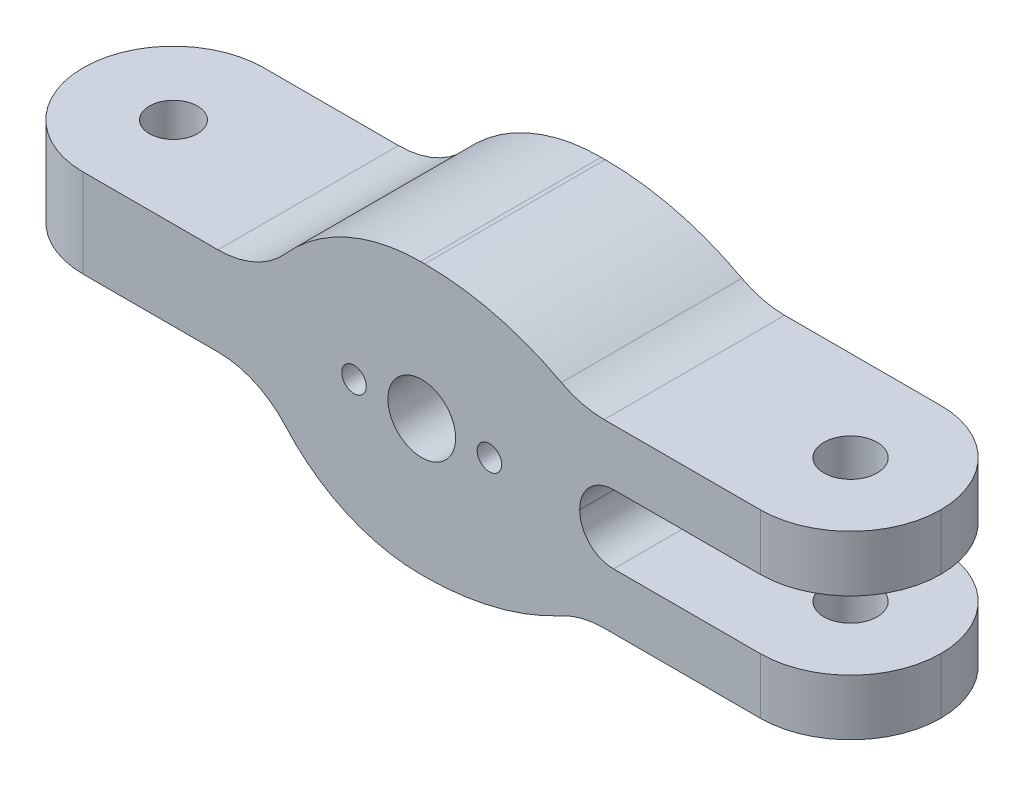
from build123d import *

# Parameters (mm, degrees)
SKETCH1_W                   = 120.65
SKETCH1_H                   = 38.1
BOSS_EXTRUDE1_DEPTH         = 12.7
SKETCH2_R                   = 14.351
CUT_EXTRUDE1_DEPTH          = 12.7
F_8_32_TAPPED_HOLE1_D       = 3.4544
F_8_32_TAPPED_HOLE1_DEPTH   = 12.7
F_8_32_TAPPED_HOLE1_TIP     = 1.037806461
CUT_EXTRUDE2_REACH          = 70.17
SKETCH7_R                   = 4.7625
FILLET1_R                   = 12.7
SKETCH12_W                  = 38.1
SKETCH12_H                  = 12.827
SKETCH12_H_2                = 9.652
SKETCH12_H_3                = 6.35
CUT_EXTRUDE6_DEPTH          = 69.170141008
SKETCH13_R                  = 3.7465
CUT_EXTRUDE7_DEPTH          = 73.470722537
F_1_4_CLEARANCE_HOLE1_D     = 6.7564
F_1_4_CLEARANCE_HOLE1_DEPTH = 19.05
F_1_4_CLEARANCE_HOLE1_TIP   = 2.029827343
CHAMFER1_SIZE               = 2.54
FILLET2_R                   = 25.4
FILLET3_R                   = 12.7
FILLET4_R                   = 40.64
FILLET5_R                   = 12.7
FILLET6_R                   = 4.7625


# Some blends are built 0.0001 mm under size
with BuildPart() as part:
    # Sketch1 → Boss-Extrude1 (new, symmetric)
    with BuildSketch(Plane.XY):
        Rectangle(SKETCH1_W, SKETCH1_H)
    extrude(amount=BOSS_EXTRUDE1_DEPTH, both=True)

    # Sketch2 → Cut-Extrude1 (cut)
    with BuildSketch(Plane(origin=(0, 0, -12.7), x_dir=(-1, 0, 0), z_dir=(0, 0, -1))):
        Circle(SKETCH2_R)
    extrude(amount=-CUT_EXTRUDE1_DEPTH, mode=Mode.SUBTRACT)

    # #8-32 Tapped Hole1
    with Locations(Plane.XY.offset(12.7)):
        with Locations((9.525, 0), (-9.525, 0)):
            Hole(F_8_32_TAPPED_HOLE1_D / 2, depth=F_8_32_TAPPED_HOLE1_DEPTH)
            with Locations((0, 0, -(F_8_32_TAPPED_HOLE1_DEPTH + F_8_32_TAPPED_HOLE1_TIP / 2))):  # 118° drill point
                Cone(0, F_8_32_TAPPED_HOLE1_D / 2, F_8_32_TAPPED_HOLE1_TIP, mode=Mode.SUBTRACT)

    # Sketch7 → Cut-Extrude2 (cut, up to next)
    with BuildSketch(Plane.XY.offset(12.7), mode=Mode.PRIVATE) as cut_extrude2_sk1:
        Circle(SKETCH7_R)
    cut_extrude2_tool1 = extrude(cut_extrude2_sk1.sketch, amount=-CUT_EXTRUDE2_REACH, mode=Mode.PRIVATE) & part.part
    add(cut_extrude2_tool1.solids().sort_by_distance((0, 0, 12.7))[0], mode=Mode.SUBTRACT)

    # Fillet1
    fillet1_edges = [part.edges().sort_by_distance(p)[0] for p in [
        (-60.325, 0, 12.7),
        (-60.325, 0, -12.7),
        (60.325, 0, 12.7),
        (60.325, 0, -12.7),
    ]]
    fillet(fillet1_edges, radius=FILLET1_R - 0.0001)  # a hair under: the kernel refuses the full size

    # Sketch12 → Cut-Extrude6 (cut, through all)
    with BuildSketch(Plane.XY.offset(12.7)):
        with Locations((-41.275, 12.6365)):
            Rectangle(SKETCH12_W, SKETCH12_H)
        with Locations((41.275, 0)):
            Rectangle(SKETCH12_W, SKETCH12_H_2)
        with Locations((-41.275, -12.6365)):
            Rectangle(SKETCH12_W, SKETCH12_H)
        with Locations((41.275, 15.875)):
            Rectangle(SKETCH12_W, SKETCH12_H_3)
        with Locations((41.275, -15.875)):
            Rectangle(SKETCH12_W, SKETCH12_H_3)
    extrude(amount=-CUT_EXTRUDE6_DEPTH, mode=Mode.SUBTRACT)

    # Sketch13 → Cut-Extrude7 (cut, through all)
    with BuildSketch(Plane(origin=(0, 19.05, 0), x_dir=(1, 0, 0), z_dir=(0, 1, 0))):
        with Locations(Location((47.625, 0, 0), (0, 0, 270))):
            Circle(SKETCH13_R)
    extrude(amount=-CUT_EXTRUDE7_DEPTH, mode=Mode.SUBTRACT)

    # 1/4 Clearance Hole1
    with Locations(Plane(origin=(0, 9.525, -30.597499938), x_dir=(0, 0, 1), z_dir=(0, 1, 0))):
        with Locations((30.597499938, -47.625), (62.347499938, -47.625), (81.397499938, -47.625), (196.332499938, -47.625)):
            Hole(F_1_4_CLEARANCE_HOLE1_D / 2, depth=F_1_4_CLEARANCE_HOLE1_DEPTH)
            with Locations((0, 0, -(F_1_4_CLEARANCE_HOLE1_DEPTH + F_1_4_CLEARANCE_HOLE1_TIP / 2))):  # 118° drill point
                Cone(0, F_1_4_CLEARANCE_HOLE1_D / 2, F_1_4_CLEARANCE_HOLE1_TIP, mode=Mode.SUBTRACT)

    # Chamfer1
    chamfer1_edges = [part.edges().sort_by_distance(p)[0] for p in [
        (-4.7625, 0, 0),
    ]]
    chamfer(chamfer1_edges, length=CHAMFER1_SIZE)

    # Fillet2
    # the kernel refuses this fillet: 25.4 mm, written as the material it takes off along each edge
    with BuildSketch(Plane(origin=(-22.225, -19.05, 67.874703839), x_dir=(0, 1, 0), z_dir=(0, 0, -1))) as fillet2_piece_1:
        with BuildLine():
            CenterArc((25.4, 22.069881536), FILLET2_R, 180, 60.330249663)
            Line((0, 22.069881536), (-0.508, 22.069881536))
            Line((-0.508, 22.069881536), (-0.508, 0))
            Line((-0.508, 0), (0, -0.508))
            ThreePointArc((0, -0.508), (6.4135, -0.508), (12.57554, -0.441397631))
            Line((12.57554, -0.441397631), (12.827, 0))
        make_face()
    extrude(amount=135.749407679, mode=Mode.SUBTRACT)
    with BuildSketch(Plane(origin=(-22.225, 19.05, 67.874703839), x_dir=(0, -1, 0), z_dir=(0, 0, -1))) as fillet2_piece_2:
        with BuildLine():
            CenterArc((25.4, -22.069881536), FILLET2_R, 119.669750337, 60.330249663)
            Line((0, -22.069881536), (-0.508, -22.069881536))
            Line((-0.508, -22.069881536), (-0.508, 0))
            Line((-0.508, 0), (0, 0.508))
            ThreePointArc((0, 0.508), (6.4135, 0.508), (12.57554, 0.441397631))
            Line((12.57554, 0.441397631), (12.827, 0))
        make_face()
    extrude(amount=135.749407679, mode=Mode.SUBTRACT)

    # Fillet3
    fillet3_edges = [part.edges().sort_by_distance(p)[0] for p in [
        (-22.225, 6.223, 0),
        (-22.225, -6.223, 0),
    ]]
    fillet(fillet3_edges, radius=FILLET3_R)

    # Fillet4
    # the kernel refuses this fillet: 40.64 mm, written as the material it takes off along each edge
    with BuildSketch(Plane(origin=(22.225, -19.05, 67.232415818), x_dir=(-1, 0, 0), z_dir=(0, 0, -1))) as fillet4_piece_1:
        with BuildLine():
            CenterArc((21.812966327, 40.64), FILLET4_R, 237.538255033, 32.461744967)
            Line((0, 6.35), (-0.436259327, 5.6642))
            ThreePointArc((-0.436259327, 5.6642), (-0.8128, 3.175), (-0.8128, 0))
            Line((-0.8128, 0), (0, -0.8128))
            Line((0, -0.8128), (21.812966327, -0.8128))
            Line((21.812966327, -0.8128), (21.812966327, 0))
        make_face()
    extrude(amount=134.464831637, mode=Mode.SUBTRACT)
    with BuildSketch(Plane(origin=(22.225, 19.05, 67.232415818), x_dir=(-1, 0, 0), z_dir=(0, 0, -1))) as fillet4_piece_2:
        with BuildLine():
            CenterArc((21.812966327, -40.64), FILLET4_R, 90, 32.461744967)
            Line((0, -6.35), (-0.436259327, -5.6642))
            ThreePointArc((-0.436259327, -5.6642), (-0.8128, -3.175), (-0.8128, 0))
            Line((-0.8128, 0), (0, 0.8128))
            Line((0, 0.8128), (21.812966327, 0.8128))
            Line((21.812966327, 0.8128), (21.812966327, 0))
        make_face()
    extrude(amount=134.464831637, mode=Mode.SUBTRACT)

    # Fillet5
    fillet5_edges = [part.edges().sort_by_distance(p)[0] for p in [
        (22.225, 12.7, 0),
        (22.225, -12.7, 0),
    ]]
    fillet(fillet5_edges, radius=FILLET5_R)

    # Fillet6
    fillet6_edges = [part.edges().sort_by_distance(p)[0] for p in [
        (22.225, -4.826, 0),
        (22.225, 4.826, 0),
    ]]
    fillet(fillet6_edges, radius=FILLET6_R)


solid = part.part
